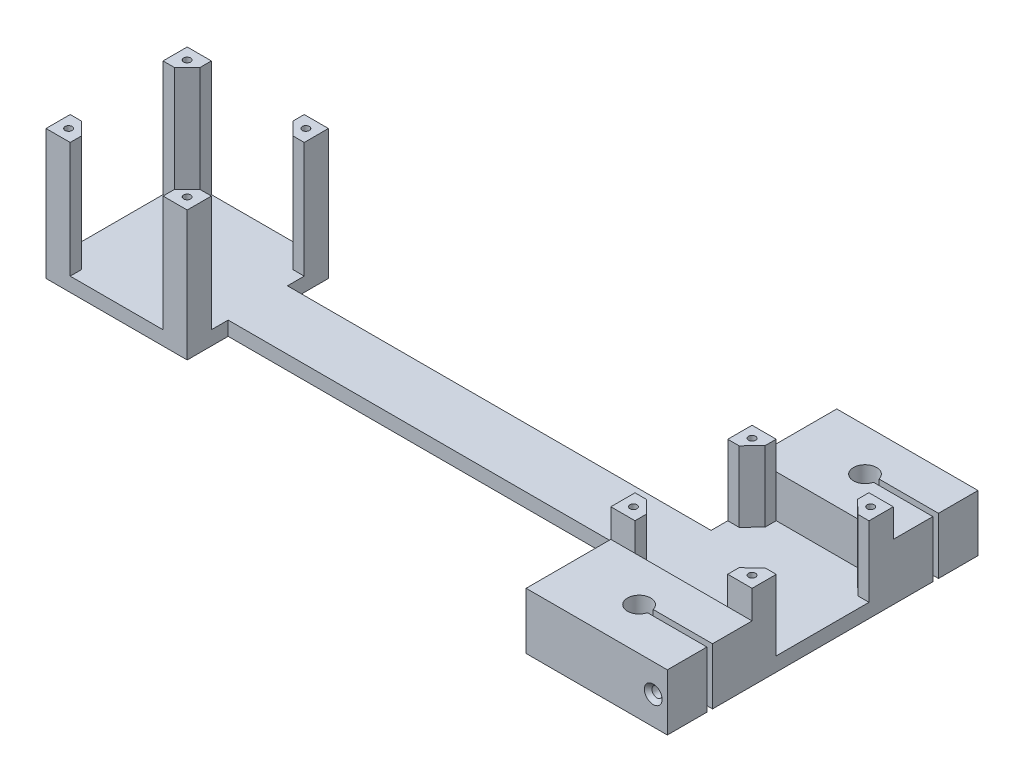
from build123d import *

# Parameters (mm, degrees)
BASE_EXTR_DEPTH                                 = 5
MOTOR_1_EXTR_DEPTH                              = 41
SHAFT_MOTOR_SUPPORT_EXTR_DEPTH                  = 25
TAP_DRILL_FOR_M3X0_5_TAP1_D                     = 2.5
TAP_DRILL_FOR_M3X0_5_TAP1_DEPTH                 = 41
TAP_DRILL_FOR_M3X0_5_TAP1_TIP                   = 0.751075774
BOSS_EXTRUDE10_DEPTH                            = 20
CSK_FOR_M3_OVAL_HEAD_MACHINE_SCREW1_D           = 3.6
CSK_FOR_M3_OVAL_HEAD_MACHINE_SCREW1_DEPTH       = 14
CSK_FOR_M3_OVAL_HEAD_MACHINE_SCREW1_CSINK_D     = 6.3
CSK_FOR_M3_OVAL_HEAD_MACHINE_SCREW1_CSINK_ANGLE = 90
CSK_FOR_M3_OVAL_HEAD_MACHINE_SCREW1_TIP         = 1.081549114
CSK_FOR_M3_OVAL_HEAD_MACHINE_SCREW2_D           = 3.6
CSK_FOR_M3_OVAL_HEAD_MACHINE_SCREW2_DEPTH       = 14
CSK_FOR_M3_OVAL_HEAD_MACHINE_SCREW2_CSINK_D     = 6.3
CSK_FOR_M3_OVAL_HEAD_MACHINE_SCREW2_CSINK_ANGLE = 90
CSK_FOR_M3_OVAL_HEAD_MACHINE_SCREW2_TIP         = 1.081549114
TAP_DRILL_FOR_M3X0_5_TAP2_D                     = 2.5
TAP_DRILL_FOR_M3X0_5_TAP2_DEPTH                 = 14
TAP_DRILL_FOR_M3X0_5_TAP2_TIP                   = 0.751075774
TAP_DRILL_FOR_M3X0_5_TAP3_D                     = 2.5
TAP_DRILL_FOR_M3X0_5_TAP3_DEPTH                 = 14
TAP_DRILL_FOR_M3X0_5_TAP3_TIP                   = 0.751075774


with BuildPart() as part:
    # Base_sch → base_extr (new body)
    with BuildSketch(Plane(origin=(0, 0, 0), x_dir=(1, 0, 0), z_dir=(0, 1, 0))):
        Polygon((25, 10.5), (25, 25), (-25, 25), (-25, -25), (25, -25), (25, -10.5), (175, -10.5), (175, -25), (225.013827764, -25), (225.013827764, 25), (175, 25), (175, 10.5), align=None)
    extrude(amount=BASE_EXTR_DEPTH)

    # motor_support_sch → Motor_1_extr (add)
    with BuildSketch(Plane(origin=(0, 5, 0), x_dir=(1, 0, 0), z_dir=(0, 1, 0))):
        Polygon((-25, 16.439389634), (-25, 25), (-16.439389634, 25), (-16.439389634, 21), (-18.719694817, 18.719694817), (-21, 16.439389634), align=None)
        Polygon((16.439389634, 25), (25, 25), (25, 16.439389634), (21, 16.439389634), (18.719694817, 18.719694817), (16.439389634, 21), align=None)
        Polygon((25, -16.439389634), (25, -25), (16.439389634, -25), (16.439389634, -21), (18.719694817, -18.719694817), (21, -16.439389634), align=None)
        Polygon((-18.719694817, -18.719694817), (-21, -16.439389634), (-25, -16.439389634), (-25, -25), (-16.439389634, -25), (-16.439389634, -21), align=None)
    extrude(amount=MOTOR_1_EXTR_DEPTH)

    # shaft_motor_support_sch → shaft_motor_support_extr (add)
    with BuildSketch(Plane(origin=(0, 5, 0), x_dir=(1, 0, 0), z_dir=(0, 1, 0))):
        Polygon((183.560610366, -21), (179, -16.439389634), (175, -16.439389634), (175, -25), (183.560610366, -25), align=None)
        Polygon((216.38573482, -21), (216.38573482, -25), (225.013827764, -25), (225.013827764, -16.439389634), (221.056642929, -16.439389634), align=None)
        Polygon((183.560610366, 25), (175, 25), (175, 16.402508948), (179, 16.402508948), (183.560610366, 21.024047525), align=None)
        Polygon((225.013827764, 25), (216.38573482, 25), (216.38573482, 21.024047525), (221.056642929, 16.402508948), (225.013827764, 16.402508948), align=None)
    extrude(amount=SHAFT_MOTOR_SUPPORT_EXTR_DEPTH)

    # Tap Drill for M3x0.5 Tap1
    with Locations(Plane(origin=(0, 46, 0), x_dir=(1, 0, 0), z_dir=(0, 1, 0))):
        with Locations((-21, -21), (21, -21), (21, 21), (-21, 21), (179.013827764, 21), (221.013827764, 21), (221.013827764, -21), (179.013827764, -21)):
            Hole(TAP_DRILL_FOR_M3X0_5_TAP1_D / 2, depth=TAP_DRILL_FOR_M3X0_5_TAP1_DEPTH)
            with Locations((0, 0, -(TAP_DRILL_FOR_M3X0_5_TAP1_DEPTH + TAP_DRILL_FOR_M3X0_5_TAP1_TIP / 2))):  # 118° drill point
                Cone(0, TAP_DRILL_FOR_M3X0_5_TAP1_D / 2, TAP_DRILL_FOR_M3X0_5_TAP1_TIP, mode=Mode.SUBTRACT)

    # Sketch12 → Boss-Extrude10 (add)
    with BuildSketch(Plane.XZ):
        with BuildLine():
            Line((175, 25), (175, 55))
            Line((175, 55), (225.013827764, 55))
            Line((225.013827764, 55), (225.013827764, 41))
            Line((225.013827764, 41), (203.983092952, 41))
            ThreePointArc((203.983092952, 41), (195.906913882, 40), (203.983092952, 39))
            Line((203.983092952, 39), (225.013827764, 39))
            Line((225.013827764, 39), (225.013827764, 25))
            Line((225.013827764, 25), (175, 25))
        make_face()
        with BuildLine():
            Line((175, -25), (175, -55))
            Line((175, -55), (225.013827764, -55))
            Line((225.013827764, -55), (225.013827764, -41))
            Line((225.013827764, -41), (203.983092952, -41))
            ThreePointArc((203.983092952, -41), (195.906913882, -40), (203.983092952, -39))
            Line((203.983092952, -39), (225.013827764, -39))
            Line((225.013827764, -39), (225.013827764, -25))
            Line((225.013827764, -25), (175, -25))
        make_face()
    extrude(amount=-BOSS_EXTRUDE10_DEPTH)

    # CSK for M3 Oval Head Machine Screw1
    with Locations(Plane(origin=(220.013827764, 10, 55), x_dir=(1, 0, 0), z_dir=(0, 0, 1))):
        with Locations((0, 0)):
            CounterSinkHole(CSK_FOR_M3_OVAL_HEAD_MACHINE_SCREW1_D / 2, CSK_FOR_M3_OVAL_HEAD_MACHINE_SCREW1_CSINK_D / 2, depth=CSK_FOR_M3_OVAL_HEAD_MACHINE_SCREW1_DEPTH, counter_sink_angle=CSK_FOR_M3_OVAL_HEAD_MACHINE_SCREW1_CSINK_ANGLE)
            with Locations((0, 0, -(CSK_FOR_M3_OVAL_HEAD_MACHINE_SCREW1_DEPTH + CSK_FOR_M3_OVAL_HEAD_MACHINE_SCREW1_TIP / 2))):  # 118° drill point
                Cone(0, CSK_FOR_M3_OVAL_HEAD_MACHINE_SCREW1_D / 2, CSK_FOR_M3_OVAL_HEAD_MACHINE_SCREW1_TIP, mode=Mode.SUBTRACT)

    # CSK for M3 Oval Head Machine Screw2
    with Locations(Plane(origin=(220.013827764, 10, -55), x_dir=(-1, 0, 0), z_dir=(0, 0, -1))):
        with Locations((0, 0)):
            CounterSinkHole(CSK_FOR_M3_OVAL_HEAD_MACHINE_SCREW2_D / 2, CSK_FOR_M3_OVAL_HEAD_MACHINE_SCREW2_CSINK_D / 2, depth=CSK_FOR_M3_OVAL_HEAD_MACHINE_SCREW2_DEPTH, counter_sink_angle=CSK_FOR_M3_OVAL_HEAD_MACHINE_SCREW2_CSINK_ANGLE)
            with Locations((0, 0, -(CSK_FOR_M3_OVAL_HEAD_MACHINE_SCREW2_DEPTH + CSK_FOR_M3_OVAL_HEAD_MACHINE_SCREW2_TIP / 2))):  # 118° drill point
                Cone(0, CSK_FOR_M3_OVAL_HEAD_MACHINE_SCREW2_D / 2, CSK_FOR_M3_OVAL_HEAD_MACHINE_SCREW2_TIP, mode=Mode.SUBTRACT)

    # Tap Drill for M3x0.5 Tap2
    with Locations(Plane(origin=(0, 0, -39), x_dir=(-1, 0, 0), z_dir=(0, 0, -1))):
        with Locations((-220.013827764, 10)):
            Hole(TAP_DRILL_FOR_M3X0_5_TAP2_D / 2, depth=TAP_DRILL_FOR_M3X0_5_TAP2_DEPTH)
            with Locations((0, 0, -(TAP_DRILL_FOR_M3X0_5_TAP2_DEPTH + TAP_DRILL_FOR_M3X0_5_TAP2_TIP / 2))):  # 118° drill point
                Cone(0, TAP_DRILL_FOR_M3X0_5_TAP2_D / 2, TAP_DRILL_FOR_M3X0_5_TAP2_TIP, mode=Mode.SUBTRACT)

    # Tap Drill for M3x0.5 Tap3
    with Locations(Plane.XY.offset(39)):
        with Locations((220.013827764, 10)):
            Hole(TAP_DRILL_FOR_M3X0_5_TAP3_D / 2, depth=TAP_DRILL_FOR_M3X0_5_TAP3_DEPTH)
            with Locations((0, 0, -(TAP_DRILL_FOR_M3X0_5_TAP3_DEPTH + TAP_DRILL_FOR_M3X0_5_TAP3_TIP / 2))):  # 118° drill point
                Cone(0, TAP_DRILL_FOR_M3X0_5_TAP3_D / 2, TAP_DRILL_FOR_M3X0_5_TAP3_TIP, mode=Mode.SUBTRACT)


solid = part.part
